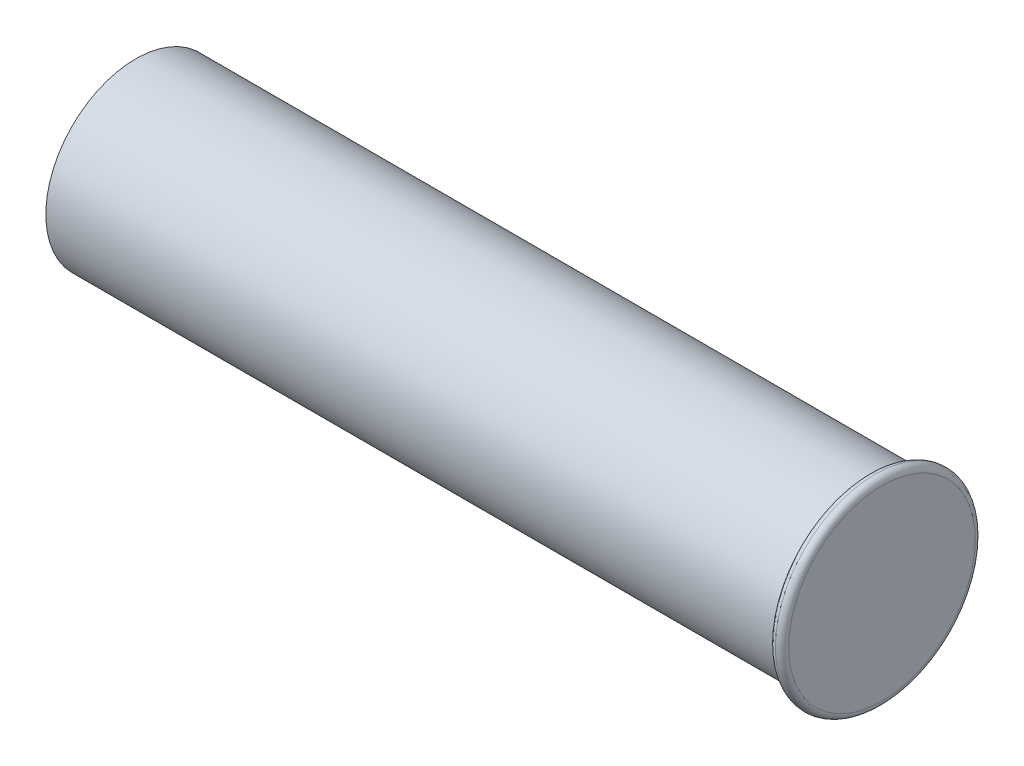
from build123d import *

# Parameters (mm, degrees)
SKETCH1_R           = 13.5
SKETCH1_R_2         = 12.5
BOSS_EXTRUDE5_DEPTH = 110
SKETCH4_R           = 15
BOSS_EXTRUDE6_DEPTH = 2
FILLET7_R           = 1


with BuildPart() as part:
    # Sketch1 → Boss-Extrude5 (new body)
    with BuildSketch(Plane(origin=(0, 0, 0), x_dir=(0, 0, -1), z_dir=(1, 0, 0))):
        Circle(SKETCH1_R)
        Circle(SKETCH1_R_2, mode=Mode.SUBTRACT)
    extrude(amount=BOSS_EXTRUDE5_DEPTH)

    # Sketch4 → Boss-Extrude6 (add)
    with BuildSketch(Plane(origin=(110, 0, 0), x_dir=(0, 0, -1), z_dir=(1, 0, 0))):
        Circle(SKETCH4_R)
    extrude(amount=BOSS_EXTRUDE6_DEPTH)

    # Fillet7
    fillet7_edges = [part.edges().sort_by_distance(p)[0] for p in [
        (110, 0, 15),
        (112, 0, 15),
    ]]
    fillet(fillet7_edges, radius=FILLET7_R - 0.0001)  # a hair under: the kernel refuses the full size


solid = part.part
